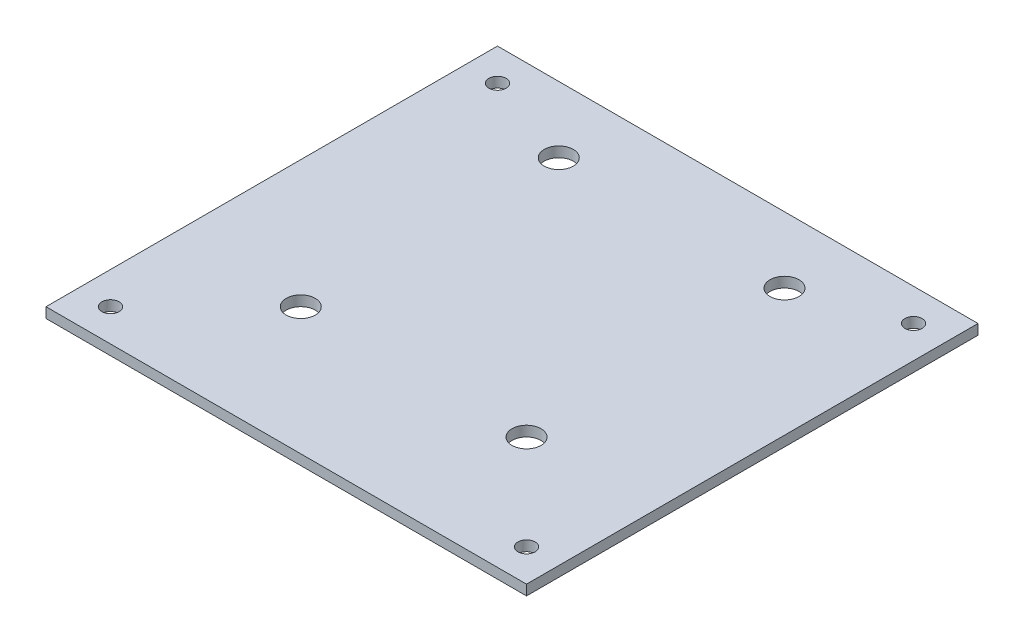
from build123d import *

# Parameters (mm, degrees)
SKETCH1_W           = 149
SKETCH1_H           = 140
BOSS_EXTRUDE1_DEPTH = 3.175
CUT_EXTRUDE1_REACH  = 104.276
SKETCH2_R           = 4.5
CUT_EXTRUDE2_REACH  = 104.276
SKETCH3_R           = 2.665


with BuildPart() as part:
    # Sketch1 → Boss-Extrude1 (new body)
    with BuildSketch(Plane(origin=(0, 0, 0), x_dir=(1, 0, 0), z_dir=(0, 1, 0))):
        Rectangle(SKETCH1_W, SKETCH1_H)
    extrude(amount=BOSS_EXTRUDE1_DEPTH)

    # Sketch2 → Cut-Extrude1 (cut, up to next)
    with BuildSketch(Plane(origin=(0, 3.175, 0), x_dir=(1, 0, 0), z_dir=(0, 1, 0)), mode=Mode.PRIVATE) as cut_extrude1_sk1:
        with Locations((-35, 49.5)):
            Circle(SKETCH2_R)
    cut_extrude1_tool1 = extrude(cut_extrude1_sk1.sketch, amount=-CUT_EXTRUDE1_REACH, mode=Mode.PRIVATE) & part.part
    # Sketch2 → Cut-Extrude1 (cut, up to next)
    with BuildSketch(Plane(origin=(0, 3.175, 0), x_dir=(1, 0, 0), z_dir=(0, 1, 0)), mode=Mode.PRIVATE) as cut_extrude1_sk2:
        with Locations((-35, -30.5)):
            Circle(SKETCH2_R)
    cut_extrude1_tool2 = extrude(cut_extrude1_sk2.sketch, amount=-CUT_EXTRUDE1_REACH, mode=Mode.PRIVATE) & part.part
    # Sketch2 → Cut-Extrude1 (cut, up to next)
    with BuildSketch(Plane(origin=(0, 3.175, 0), x_dir=(1, 0, 0), z_dir=(0, 1, 0)), mode=Mode.PRIVATE) as cut_extrude1_sk3:
        with Locations((35, -30.5)):
            Circle(SKETCH2_R)
    cut_extrude1_tool3 = extrude(cut_extrude1_sk3.sketch, amount=-CUT_EXTRUDE1_REACH, mode=Mode.PRIVATE) & part.part
    # Sketch2 → Cut-Extrude1 (cut, up to next)
    with BuildSketch(Plane(origin=(0, 3.175, 0), x_dir=(1, 0, 0), z_dir=(0, 1, 0)), mode=Mode.PRIVATE) as cut_extrude1_sk4:
        with Locations((35, 49.5)):
            Circle(SKETCH2_R)
    cut_extrude1_tool4 = extrude(cut_extrude1_sk4.sketch, amount=-CUT_EXTRUDE1_REACH, mode=Mode.PRIVATE) & part.part
    add(cut_extrude1_tool1.solids().sort_by_distance((-35, 3.175, -49.5))[0], mode=Mode.SUBTRACT)
    add(cut_extrude1_tool2.solids().sort_by_distance((-35, 3.175, 30.5))[0], mode=Mode.SUBTRACT)
    add(cut_extrude1_tool3.solids().sort_by_distance((35, 3.175, 30.5))[0], mode=Mode.SUBTRACT)
    add(cut_extrude1_tool4.solids().sort_by_distance((35, 3.175, -49.5))[0], mode=Mode.SUBTRACT)

    # Sketch3 → Cut-Extrude2 (cut, up to next)
    with BuildSketch(Plane(origin=(0, 3.175, 0), x_dir=(-1, 0, 0), z_dir=(0, 1, 0)), mode=Mode.PRIVATE) as cut_extrude2_sk1:
        with Locations((64.5, 60)):
            Circle(SKETCH3_R)
    cut_extrude2_tool1 = extrude(cut_extrude2_sk1.sketch, amount=-CUT_EXTRUDE2_REACH, mode=Mode.PRIVATE) & part.part
    # Sketch3 → Cut-Extrude2 (cut, up to next)
    with BuildSketch(Plane(origin=(0, 3.175, 0), x_dir=(-1, 0, 0), z_dir=(0, 1, 0)), mode=Mode.PRIVATE) as cut_extrude2_sk2:
        with Locations((-64.5, 60)):
            Circle(SKETCH3_R)
    cut_extrude2_tool2 = extrude(cut_extrude2_sk2.sketch, amount=-CUT_EXTRUDE2_REACH, mode=Mode.PRIVATE) & part.part
    # Sketch3 → Cut-Extrude2 (cut, up to next)
    with BuildSketch(Plane(origin=(0, 3.175, 0), x_dir=(-1, 0, 0), z_dir=(0, 1, 0)), mode=Mode.PRIVATE) as cut_extrude2_sk3:
        with Locations((-64.5, -60)):
            Circle(SKETCH3_R)
    cut_extrude2_tool3 = extrude(cut_extrude2_sk3.sketch, amount=-CUT_EXTRUDE2_REACH, mode=Mode.PRIVATE) & part.part
    # Sketch3 → Cut-Extrude2 (cut, up to next)
    with BuildSketch(Plane(origin=(0, 3.175, 0), x_dir=(-1, 0, 0), z_dir=(0, 1, 0)), mode=Mode.PRIVATE) as cut_extrude2_sk4:
        with Locations((64.5, -60)):
            Circle(SKETCH3_R)
    cut_extrude2_tool4 = extrude(cut_extrude2_sk4.sketch, amount=-CUT_EXTRUDE2_REACH, mode=Mode.PRIVATE) & part.part
    add(cut_extrude2_tool1.solids().sort_by_distance((-64.5, 3.175, 60))[0], mode=Mode.SUBTRACT)
    add(cut_extrude2_tool2.solids().sort_by_distance((64.5, 3.175, 60))[0], mode=Mode.SUBTRACT)
    add(cut_extrude2_tool3.solids().sort_by_distance((64.5, 3.175, -60))[0], mode=Mode.SUBTRACT)
    add(cut_extrude2_tool4.solids().sort_by_distance((-64.5, 3.175, -60))[0], mode=Mode.SUBTRACT)


solid = part.part
